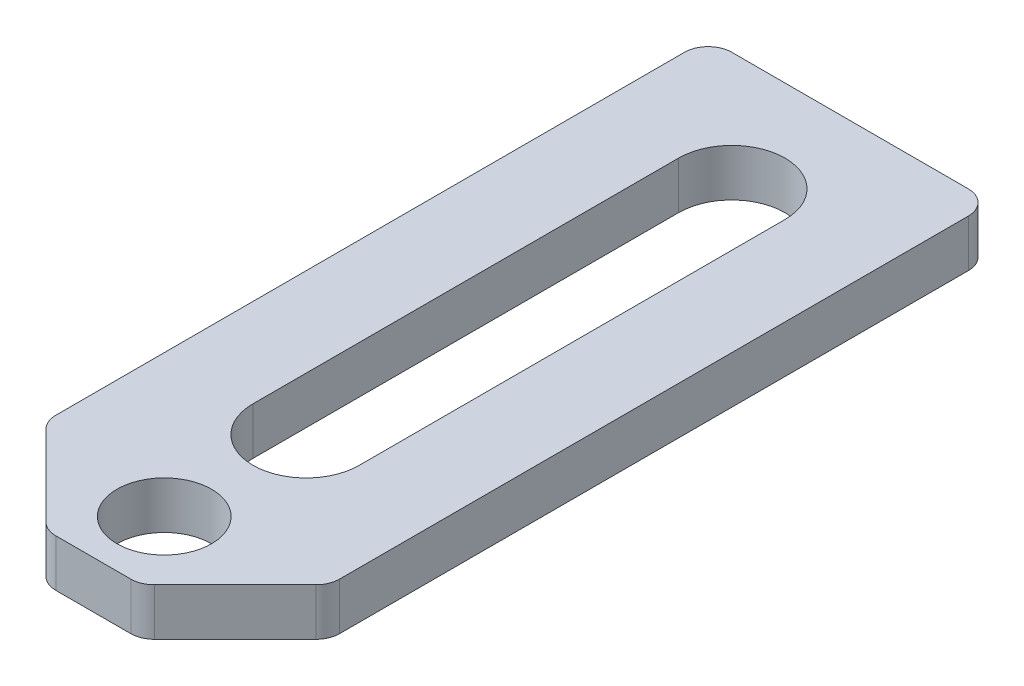
from build123d import *

# Parameters (mm, degrees)
SKETCH1_W                   = 19.05
SKETCH1_H                   = 3.175
EXTRUDE1_DEPTH              = 25.4
CUT_EXTRUDE1_DEPTH          = 28.312382723
CHAMFER1_SIZE               = 6.35
F_1_4_0_25_DIAMETER_HOLE1_D = 6.35
FILLET1_R                   = 1.5875


with BuildPart() as part:
    # Sketch1 → Extrude1 (new, symmetric)
    with BuildSketch(Plane.XY):
        Rectangle(SKETCH1_W, SKETCH1_H)
    extrude(amount=EXTRUDE1_DEPTH, both=True)

    # Sketch2 → Cut-Extrude1 (cut, through all)
    with BuildSketch(Plane(origin=(0, 1.5875, 0), x_dir=(-1, 0, 0), z_dir=(0, 1, 0))):
        with BuildLine():
            Line((3.571875, -17.4625), (3.571875, 11.1125))
            ThreePointArc((3.571875, 11.1125), (0, 14.684375), (-3.571875, 11.1125))
            Line((-3.571875, 11.1125), (-3.571875, -17.4625))
            ThreePointArc((-3.571875, -17.4625), (0, -21.034375), (3.571875, -17.4625))
        make_face()
    extrude(amount=-CUT_EXTRUDE1_DEPTH, mode=Mode.SUBTRACT)

    # Chamfer1
    chamfer1_edges = [part.edges().sort_by_distance(p)[0] for p in [
        (9.525, 0, 25.4),
        (-9.525, 0, 25.4),
    ]]
    chamfer(chamfer1_edges, length=CHAMFER1_SIZE)

    # 1/4 (0.25) Diameter Hole1 (through all)
    with Locations(Plane(origin=(0, 1.5875, 0), x_dir=(-1, 0, 0), z_dir=(0, 1, 0))):
        with Locations((0, 20.6375)):
            Hole(F_1_4_0_25_DIAMETER_HOLE1_D / 2)

    # Fillet1
    fillet1_edges = [part.edges().sort_by_distance(p)[0] for p in [
        (3.175, 0, 25.4),
        (-3.175, 0, 25.4),
        (-9.525, 0, 19.05),
        (9.525, 0, 19.05),
        (9.525, 0, -25.4),
        (-9.525, 0, -25.4),
    ]]
    fillet(fillet1_edges, radius=FILLET1_R)


solid = part.part
